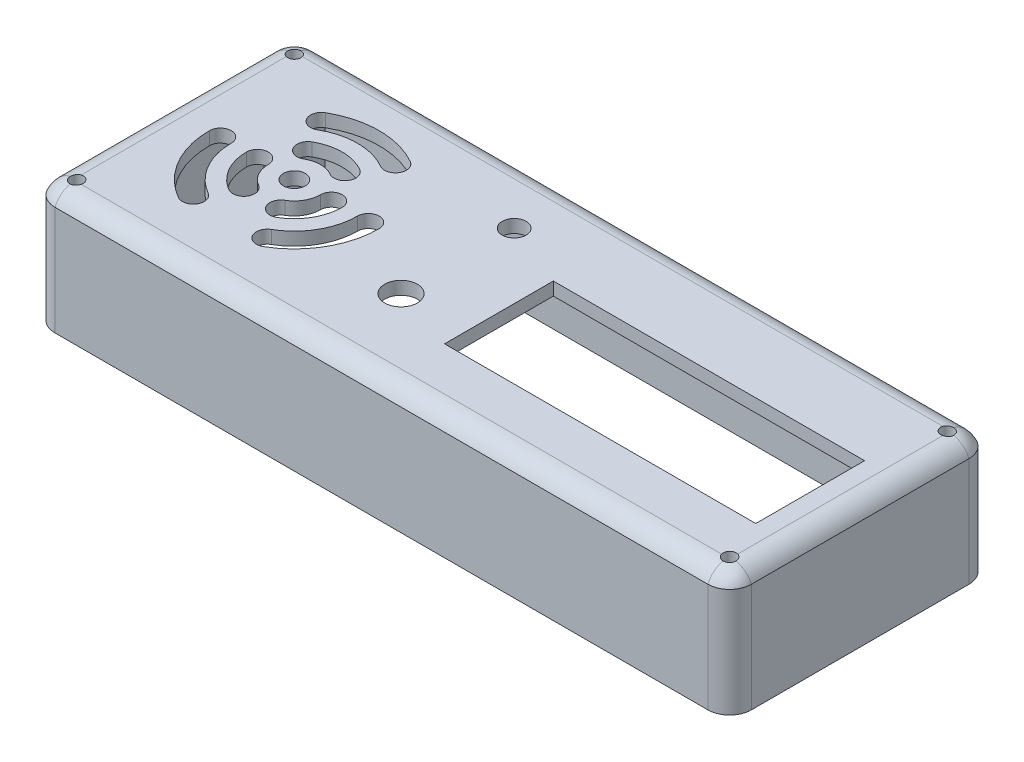
from build123d import *

# Parameters (mm, degrees)
BOSS_EXTRUDE1_DEPTH     = 3
FILLET1_R               = 5
CUT_EXTRUDE1_DEPTH      = 165.496200564
CUT_EXTRUDE1_DEPTH_BACK = 165.496200564
SKETCH2_R               = 1.5
CUT_EXTRUDE2_DEPTH      = 165.496200694
CUT_EXTRUDE2_DEPTH_BACK = 165.496200694
SKETCH3_R               = 2.5
CUT_EXTRUDE3_DEPTH      = 165.496200694
CUT_EXTRUDE3_DEPTH_BACK = 165.496200694
SKETCH4_R               = 3.75
SKETCH4_R_2             = 2.75
SKETCH4_W               = 71.5
SKETCH4_H               = 25
SKETCH5_R               = 1.5
BOSS_EXTRUDE2_DEPTH     = 25


with BuildPart() as part:
    # Sketch1 → Boss-Extrude1 (new body)
    with BuildSketch(Plane(origin=(0, 0, 0), x_dir=(1, 0, 0), z_dir=(0, 1, 0))):
        with BuildLine():
            Line((0, 5), (150, 5))
            ThreePointArc((150, 5), (153.535533906, 3.535533906), (155, 0))
            Line((155, 0), (155, -50))
            ThreePointArc((155, -50), (153.535533906, -53.535533906), (150, -55))
            Line((150, -55), (0, -55))
            ThreePointArc((0, -55), (-3.535533906, -53.535533906), (-5, -50))
            Line((-5, -50), (-5, 0))
            ThreePointArc((-5, 0), (-3.535533906, 3.535533906), (0, 5))
        make_face()
    extrude(amount=BOSS_EXTRUDE1_DEPTH)

    # Fillet1
    # the kernel refuses this fillet: 5 mm, written as the material it takes off along each edge
    with BuildSketch(Plane(origin=(0, 3, 50), x_dir=(0, 0, 1), z_dir=(1, 0, 0))) as fillet1_piece_1:
        with BuildLine():
            CenterArc((0.417424305, 5), FILLET1_R, 270, 66.421821522)
            Line((0.417424305, 0), (0.417424305, -0.1))
            Line((0.417424305, -0.1), (5, -0.1))
            Line((5, -0.1), (5.1, 0))
            ThreePointArc((5.1, 0), (5.1, 1.5), (5.091651514, 2.96))
            Line((5.091651514, 2.96), (5, 3))
        make_face()
    revolve(axis=Axis((0, 3, 50), (0, -1, 0)), revolution_arc=90, mode=Mode.SUBTRACT)
    with BuildSketch(Plane(origin=(-5, 3, 50), x_dir=(0, -1, 0), z_dir=(0, 0, -1)), Plane(origin=(155, 3, 0), x_dir=(0, -1, 0), z_dir=(0, 0, 1))) as fillet1_piece_2:
        with BuildLine():
            CenterArc((5, -4.582575695), FILLET1_R, 113.578178478, 66.421821522)
            Line((0, -4.582575695), (-0.1, -4.582575695))
            Line((-0.1, -4.582575695), (-0.1, 0))
            Line((-0.1, 0), (0, 0.1))
            ThreePointArc((0, 0.1), (1.5, 0.1), (2.96, 0.091651514))
            Line((2.96, 0.091651514), (3, 0))
        make_face()
    extrude(amount=50, mode=Mode.SUBTRACT)
    with BuildSketch(Plane(origin=(0, 3, 0), x_dir=(-1, 0, 0), z_dir=(0, 0, 1))) as fillet1_piece_3:
        with BuildLine():
            CenterArc((0.417424305, 5), FILLET1_R, 270, 66.421821522)
            Line((0.417424305, 0), (0.417424305, -0.1))
            Line((0.417424305, -0.1), (5, -0.1))
            Line((5, -0.1), (5.1, 0))
            ThreePointArc((5.1, 0), (5.1, 1.5), (5.091651514, 2.96))
            Line((5.091651514, 2.96), (5, 3))
        make_face()
    revolve(axis=Axis((0, 3, 0), (0, -1, 0)), revolution_arc=90, mode=Mode.SUBTRACT)
    with BuildSketch(Plane(origin=(0, 3, -5), x_dir=(0, -1, 0), z_dir=(1, 0, 0)), Plane(origin=(150, 3, 55), x_dir=(0, -1, 0), z_dir=(-1, 0, 0))) as fillet1_piece_4:
        with BuildLine():
            CenterArc((5, -4.582575695), FILLET1_R, 113.578178478, 66.421821522)
            Line((0, -4.582575695), (-0.1, -4.582575695))
            Line((-0.1, -4.582575695), (-0.1, 0))
            Line((-0.1, 0), (0, 0.1))
            ThreePointArc((0, 0.1), (1.5, 0.1), (2.96, 0.091651514))
            Line((2.96, 0.091651514), (3, 0))
        make_face()
    extrude(amount=150, mode=Mode.SUBTRACT)
    with BuildSketch(Plane(origin=(150, 3, 0), x_dir=(0, 0, -1), z_dir=(-1, 0, 0))) as fillet1_piece_5:
        with BuildLine():
            CenterArc((0.417424305, 5), FILLET1_R, 270, 66.421821522)
            Line((0.417424305, 0), (0.417424305, -0.1))
            Line((0.417424305, -0.1), (5, -0.1))
            Line((5, -0.1), (5.1, 0))
            ThreePointArc((5.1, 0), (5.1, 1.5), (5.091651514, 2.96))
            Line((5.091651514, 2.96), (5, 3))
        make_face()
    revolve(axis=Axis((150, 3, 0), (0, -1, 0)), revolution_arc=90, mode=Mode.SUBTRACT)
    with BuildSketch(Plane(origin=(150, 3, 50), x_dir=(1, 0, 0), z_dir=(0, 0, -1))) as fillet1_piece_6:
        with BuildLine():
            CenterArc((0.417424305, 5), FILLET1_R, 270, 66.421821522)
            Line((0.417424305, 0), (0.417424305, -0.1))
            Line((0.417424305, -0.1), (5, -0.1))
            Line((5, -0.1), (5.1, 0))
            ThreePointArc((5.1, 0), (5.1, 1.5), (5.091651514, 2.96))
            Line((5.091651514, 2.96), (5, 3))
        make_face()
    revolve(axis=Axis((150, 3, 50), (0, -1, 0)), revolution_arc=90, mode=Mode.SUBTRACT)

    # Sketch2 → Cut-Extrude1 (cut, two sides: drawn at the far end of the back side and taken through both)
    with BuildSketch(Plane(origin=(0, 3, 0), x_dir=(1, 0, 0), z_dir=(0, 1, 0)).offset(-CUT_EXTRUDE1_DEPTH_BACK)):
        with Locations(Location((0, -50, 0), (0, 0, 270))):
            Circle(SKETCH2_R)
        with Locations(Location((0, 0, 0), (0, 0, 270))):
            Circle(SKETCH2_R)
        with Locations(Location((150, -50, 0), (0, 0, 270))):
            Circle(SKETCH2_R)
        with Locations(Location((150, 0, 0), (0, 0, 270))):
            Circle(SKETCH2_R)
    extrude(amount=CUT_EXTRUDE1_DEPTH + CUT_EXTRUDE1_DEPTH_BACK, mode=Mode.SUBTRACT)

    # Sketch3 → Cut-Extrude2 (cut, two sides: drawn at the far end of the back side and taken through both)
    with BuildSketch(Plane(origin=(0, 3, 0), x_dir=(1, 0, 0), z_dir=(0, 1, 0)).offset(-CUT_EXTRUDE2_DEPTH_BACK)):
        with Locations(Location((25, -25, 0), (0, 0, 270))):
            Circle(SKETCH3_R)
        with BuildLine():
            ThreePointArc((30.5, -15.473720558), (25, -14), (19.5, -15.473720558))
            ThreePointArc((19.5, -15.473720558), (18.584936491, -18.888784068), (22, -19.803847577))
            ThreePointArc((22, -19.803847577), (25, -19), (28, -19.803847577))
            ThreePointArc((28, -19.803847577), (31.415063509, -18.888784068), (30.5, -15.473720558))
        make_face()
        with BuildLine():
            ThreePointArc((30.5, -34.526279442), (34.526279442, -30.5), (36, -25))
            ThreePointArc((36, -25), (33.5, -22.5), (31, -25))
            ThreePointArc((31, -25), (30.196152423, -28), (28, -30.196152423))
            ThreePointArc((28, -30.196152423), (27.084936491, -33.611215932), (30.5, -34.526279442))
        make_face()
        with BuildLine():
            ThreePointArc((14, -25), (15.473720558, -30.5), (19.5, -34.526279442))
            ThreePointArc((19.5, -34.526279442), (22.915063509, -33.611215932), (22, -30.196152423))
            ThreePointArc((22, -30.196152423), (19.803847577, -28), (19, -25))
            ThreePointArc((19, -25), (16.5, -22.5), (14, -25))
        make_face()
        with BuildLine():
            ThreePointArc((34.75, -8.112504626), (25, -5.5), (15.25, -8.112504626))
            ThreePointArc((15.25, -8.112504626), (14.334936491, -11.527568136), (17.75, -12.442631645))
            ThreePointArc((17.75, -12.442631645), (25, -10.5), (32.25, -12.442631645))
            ThreePointArc((32.25, -12.442631645), (35.665063509, -11.527568136), (34.75, -8.112504626))
        make_face()
        with BuildLine():
            ThreePointArc((34.75, -41.887495374), (41.887495374, -34.75), (44.5, -25))
            ThreePointArc((44.5, -25), (42, -22.5), (39.5, -25))
            ThreePointArc((39.5, -25), (37.557368355, -32.25), (32.25, -37.557368355))
            ThreePointArc((32.25, -37.557368355), (31.334936491, -40.972431864), (34.75, -41.887495374))
        make_face()
        with BuildLine():
            ThreePointArc((5.5, -25), (8.112504626, -34.75), (15.25, -41.887495374))
            ThreePointArc((15.25, -41.887495374), (18.665063509, -40.972431864), (17.75, -37.557368355))
            ThreePointArc((17.75, -37.557368355), (12.442631645, -32.25), (10.5, -25))
            ThreePointArc((10.5, -25), (8, -22.5), (5.5, -25))
        make_face()
    extrude(amount=CUT_EXTRUDE2_DEPTH + CUT_EXTRUDE2_DEPTH_BACK, mode=Mode.SUBTRACT)

    # Sketch4 → Cut-Extrude3 (cut, two sides: drawn at the far end of the back side and taken through both)
    with BuildSketch(Plane(origin=(0, 3, 0), x_dir=(1, 0, 0), z_dir=(0, 1, 0)).offset(-CUT_EXTRUDE3_DEPTH_BACK)):
        with Locations(Location((59.917424305, -35.417424305, 0), (0, 0, 270))):
            Circle(SKETCH4_R)
        with Locations(Location((59.917424305, -9.417424305, 0), (0, 0, 270))):
            Circle(SKETCH4_R_2)
        with Locations((110.667424305, -27.917424305)):
            Rectangle(SKETCH4_W, SKETCH4_H)
    extrude(amount=CUT_EXTRUDE3_DEPTH + CUT_EXTRUDE3_DEPTH_BACK, mode=Mode.SUBTRACT)

    # Sketch5 → Boss-Extrude2 (add)
    with BuildSketch(Plane.XZ):
        with BuildLine():
            Line((155, 0), (155, 50))
            ThreePointArc((155, 50), (153.535533906, 53.535533906), (150, 55))
            Line((150, 55), (0, 55))
            ThreePointArc((0, 55), (-3.535533906, 53.535533906), (-5, 50))
            Line((-5, 50), (-5, 0))
            ThreePointArc((-5, 0), (-3.535533906, -3.535533906), (0, -5))
            Line((0, -5), (150, -5))
            ThreePointArc((150, -5), (153.535533906, -3.535533906), (155, 0))
        make_face()
        with Locations(Location((0, 50, 0), (0, 0, 90))):
            Circle(SKETCH5_R, mode=Mode.SUBTRACT)
        with Locations(Location((0, 0, 0), (0, 0, 270))):
            Circle(SKETCH5_R, mode=Mode.SUBTRACT)
        with Locations(Location((150, 0, 0), (0, 0, 270))):
            Circle(SKETCH5_R, mode=Mode.SUBTRACT)
        with Locations(Location((150, 50, 0), (0, 0, 90))):
            Circle(SKETCH5_R, mode=Mode.SUBTRACT)
        with BuildLine():
            Line((4, 53), (146, 53))
            ThreePointArc((146, 53), (146.464466094, 46.464466094), (153, 46))
            Line((153, 46), (153, 4))
            ThreePointArc((153, 4), (146.464466094, 3.535533906), (146, -3))
            Line((146, -3), (4, -3))
            ThreePointArc((4, -3), (3.535533906, 3.535533906), (-3, 4))
            Line((-3, 4), (-3, 46))
            ThreePointArc((-3, 46), (3.535533906, 46.464466094), (4, 53))
        make_face(mode=Mode.SUBTRACT)
    extrude(amount=BOSS_EXTRUDE2_DEPTH)


solid = part.part
